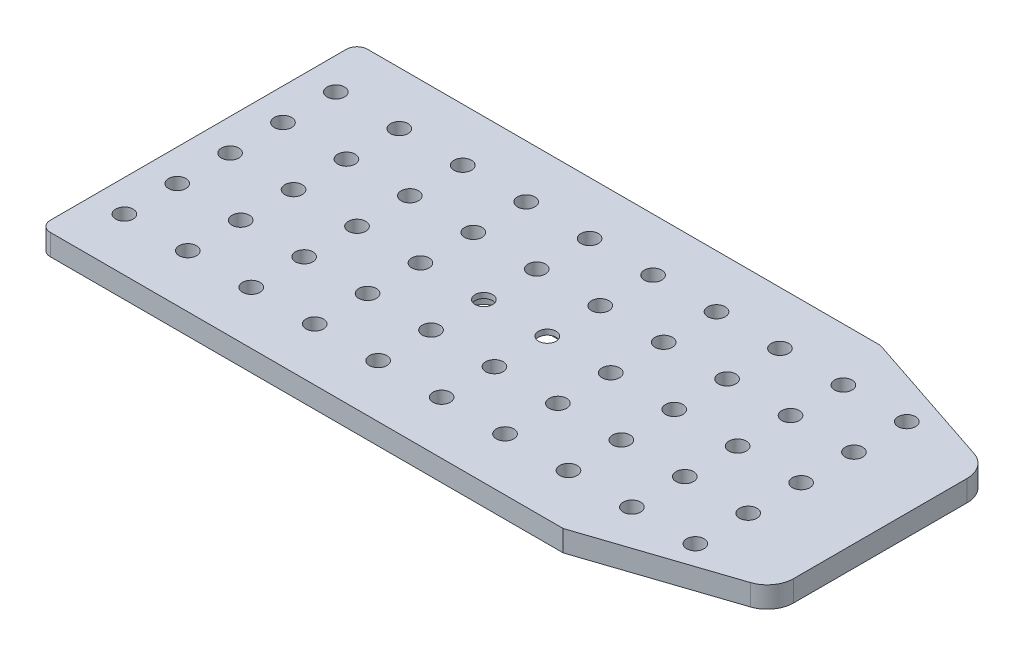
from build123d import *

# Parameters (mm, degrees)
SKETCH1_W           = 150
SKETCH1_H           = 90
BOSS_EXTRUDE1_DEPTH = 4
FILLET1_R           = 5
SKETCH2_R           = 1.65
CUT_EXTRUDE1_DEPTH  = 4
SKETCH3_R           = 2
CUT_EXTRUDE2_DEPTH  = 4
SKETCH4_W           = 62.892009783
SKETCH4_H           = 15
CUT_EXTRUDE3_DEPTH  = 33
FILLET2_R           = 5
CUT_EXTRUDE4_DEPTH  = 3
BOSS_EXTRUDE2_DEPTH = 4
FILLET3_R           = 5
SKETCH16_R          = 1.65
CUT_EXTRUDE5_DEPTH  = 3
CUT_EXTRUDE6_DEPTH  = 3
FILLET4_R           = 5
SKETCH19_W          = 109.521719542
SKETCH19_H          = 24.424509668
SKETCH19_W_2        = 104.116545636
SKETCH19_H_2        = 30.575224802
CUT_EXTRUDE7_DEPTH  = 20
CUT_EXTRUDE8_DEPTH  = 10
FILLET5_R           = 2


with BuildPart() as part:
    # Sketch1 → Boss-Extrude1 (new body)
    with BuildSketch(Plane(origin=(0, 0, 0), x_dir=(1, 0, 0), z_dir=(0, 1, 0))):
        Rectangle(SKETCH1_W, SKETCH1_H)
    extrude(amount=BOSS_EXTRUDE1_DEPTH)

    # Fillet1
    fillet1_edges = [part.edges().sort_by_distance(p)[0] for p in [
        (-75, 2, -45),
        (75, 2, -45),
        (75, 2, 45),
        (-75, 2, 45),
    ]]
    fillet(fillet1_edges, radius=FILLET1_R)

    # Sketch2 → Cut-Extrude1 (cut, symmetric)
    with BuildSketch(Plane(origin=(0, 4, 0), x_dir=(1, 0, 0), z_dir=(0, 1, 0))):
        with Locations((-70, 20)):
            Circle(SKETCH2_R)
        with Locations((-60, 20)):
            Circle(SKETCH2_R)
        with Locations((-70, 10)):
            Circle(SKETCH2_R)
        with Locations((-50, 20)):
            Circle(SKETCH2_R)
        with Locations((-70, 0)):
            Circle(SKETCH2_R)
        with Locations((-40, 20)):
            Circle(SKETCH2_R)
        with Locations((-70, -10)):
            Circle(SKETCH2_R)
        with Locations((-30, 20)):
            Circle(SKETCH2_R)
        with Locations((-70, -20)):
            Circle(SKETCH2_R)
        with Locations((-30, 10)):
            Circle(SKETCH2_R)
        with Locations((-60, -20)):
            Circle(SKETCH2_R)
        with Locations((-30, 0)):
            Circle(SKETCH2_R)
        with Locations((-50, -20)):
            Circle(SKETCH2_R)
        with Locations((-30, -10)):
            Circle(SKETCH2_R)
        with Locations((-40, -20)):
            Circle(SKETCH2_R)
        with Locations((-30, -20)):
            Circle(SKETCH2_R)
        with Locations((-60, 10)):
            Circle(SKETCH2_R)
        with Locations((-50, 10)):
            Circle(SKETCH2_R)
        with Locations((-40, 10)):
            Circle(SKETCH2_R)
        with Locations((-60, 0)):
            Circle(SKETCH2_R)
        with Locations((-50, 0)):
            Circle(SKETCH2_R)
        with Locations((-40, 0)):
            Circle(SKETCH2_R)
        with Locations((-60, -10)):
            Circle(SKETCH2_R)
        with Locations((-50, -10)):
            Circle(SKETCH2_R)
        with Locations((-40, -10)):
            Circle(SKETCH2_R)
        with Locations((-18, 20)):
            Circle(SKETCH2_R)
        with Locations((-18, 10)):
            Circle(SKETCH2_R)
        with Locations((-18, 0)):
            Circle(SKETCH2_R)
        with Locations((-18, -10)):
            Circle(SKETCH2_R)
        with Locations((-18, -20)):
            Circle(SKETCH2_R)
        with Locations((-6, 20)):
            Circle(SKETCH2_R)
        with Locations((-6, 10)):
            Circle(SKETCH2_R)
        with Locations((-6, 0)):
            Circle(SKETCH2_R)
        with Locations((-6, -10)):
            Circle(SKETCH2_R)
        with Locations((-6, -20)):
            Circle(SKETCH2_R)
        with Locations((6, 20)):
            Circle(SKETCH2_R)
        with Locations((6, 10)):
            Circle(SKETCH2_R)
        with Locations((6, 0)):
            Circle(SKETCH2_R)
        with Locations((6, -10)):
            Circle(SKETCH2_R)
        with Locations((6, -20)):
            Circle(SKETCH2_R)
        with Locations((18, 20)):
            Circle(SKETCH2_R)
        with Locations((18, 10)):
            Circle(SKETCH2_R)
        with Locations((18, 0)):
            Circle(SKETCH2_R)
        with Locations((18, -10)):
            Circle(SKETCH2_R)
        with Locations((18, -20)):
            Circle(SKETCH2_R)
        with Locations((30, 20)):
            Circle(SKETCH2_R)
        with Locations((30, 10)):
            Circle(SKETCH2_R)
        with Locations((30, 0)):
            Circle(SKETCH2_R)
        with Locations((30, -10)):
            Circle(SKETCH2_R)
        with Locations((30, -20)):
            Circle(SKETCH2_R)
        with Locations((42, 20)):
            Circle(SKETCH2_R)
        with Locations((42, 10)):
            Circle(SKETCH2_R)
        with Locations((42, 0)):
            Circle(SKETCH2_R)
        with Locations((42, -10)):
            Circle(SKETCH2_R)
        with Locations((42, -20)):
            Circle(SKETCH2_R)
        with Locations((54, 20)):
            Circle(SKETCH2_R)
        with Locations((54, 10)):
            Circle(SKETCH2_R)
        with Locations((54, 0)):
            Circle(SKETCH2_R)
        with Locations((54, -10)):
            Circle(SKETCH2_R)
        with Locations((54, -20)):
            Circle(SKETCH2_R)
    extrude(amount=CUT_EXTRUDE1_DEPTH, both=True, mode=Mode.SUBTRACT)

    # Sketch3 → Cut-Extrude2 (cut, symmetric)
    with BuildSketch(Plane(origin=(0, 4, 0), x_dir=(1, 0, 0), z_dir=(0, 1, 0))):
        with Locations((-70, 20)):
            Circle(SKETCH3_R)
    extrude(amount=CUT_EXTRUDE2_DEPTH, both=True, mode=Mode.SUBTRACT)

    # Sketch4 → Cut-Extrude3 (cut)
    with BuildSketch(Plane(origin=(0, 4, 0), x_dir=(1, 0, 0), z_dir=(0, 1, 0))):
        with Locations((-56.446004892, -37.5)):
            Rectangle(SKETCH4_W, SKETCH4_H)
        with Locations((-56.446004892, 37.5)):
            Rectangle(SKETCH4_W, SKETCH4_H)
    extrude(amount=-CUT_EXTRUDE3_DEPTH, mode=Mode.SUBTRACT)

    # Fillet2
    fillet2_edges = [part.edges().sort_by_distance(p)[0] for p in [
        (-25, 2, 45),
        (-25, 2, -45),
    ]]
    fillet(fillet2_edges, radius=FILLET2_R)

    # Sketch14 → Cut-Extrude4 (cut)
    with BuildSketch(Plane(origin=(0, 4, 0), x_dir=(1, 0, 0), z_dir=(0, 1, 0))):
        with BuildLine():
            ThreePointArc((65, 36), (68, 39), (65, 42))
            Line((65, 42), (35, 42))
            ThreePointArc((35, 42), (32, 39), (35, 36))
            Line((35, 36), (65, 36))
        make_face()
        with BuildLine():
            ThreePointArc((15, 36), (18, 39), (15, 42))
            Line((15, 42), (-15, 42))
            ThreePointArc((-15, 42), (-18, 39), (-15, 36))
            Line((-15, 36), (15, 36))
        make_face()
        with BuildLine():
            Line((35, -42), (65, -42))
            ThreePointArc((65, -42), (68, -39), (65, -36))
            Line((65, -36), (35, -36))
            ThreePointArc((35, -36), (32, -39), (35, -42))
        make_face()
        with BuildLine():
            ThreePointArc((-15, -36), (-18, -39), (-15, -42))
            Line((-15, -42), (15, -42))
            ThreePointArc((15, -42), (18, -39), (15, -36))
            Line((15, -36), (-15, -36))
        make_face()
    extrude(amount=-CUT_EXTRUDE4_DEPTH, mode=Mode.SUBTRACT)

    # Sketch15 → Boss-Extrude2 (add)
    with BuildSketch(Plane(origin=(0, 4, 0), x_dir=(1, 0, 0), z_dir=(0, 1, 0))):
        Polygon((75, 30), (75, -30), (105, -20), (105, 20), align=None)
    extrude(amount=-BOSS_EXTRUDE2_DEPTH)

    # Fillet3
    fillet3_edges = [part.edges().sort_by_distance(p)[0] for p in [
        (105, 2, -20),
        (105, 2, 20),
    ]]
    fillet(fillet3_edges, radius=FILLET3_R)

    # Sketch16 → Cut-Extrude5 (cut)
    with BuildSketch(Plane(origin=(0, 4, 0), x_dir=(1, 0, 0), z_dir=(0, 1, 0))):
        with Locations((66, 0)):
            Circle(SKETCH16_R)
        with Locations((90, 0)):
            Circle(SKETCH16_R)
        with Locations((78, 0)):
            Circle(SKETCH16_R)
        with Locations((78, 10)):
            Circle(SKETCH16_R)
        with Locations((90, 10)):
            Circle(SKETCH16_R)
        with Locations((78, 20)):
            Circle(SKETCH16_R)
        with Locations((90, 20)):
            Circle(SKETCH16_R)
        with Locations((66, 10)):
            Circle(SKETCH16_R)
        with Locations((66, 20)):
            Circle(SKETCH16_R)
        with Locations((66, -10)):
            Circle(SKETCH16_R)
        with Locations((78, -10)):
            Circle(SKETCH16_R)
        with Locations((90, -10)):
            Circle(SKETCH16_R)
        with Locations((66, -20)):
            Circle(SKETCH16_R)
        with Locations((78, -20)):
            Circle(SKETCH16_R)
        with Locations((90, -20)):
            Circle(SKETCH16_R)
    extrude(amount=-CUT_EXTRUDE5_DEPTH, mode=Mode.SUBTRACT)

    # Sketch18 → Cut-Extrude6 (cut)
    with BuildSketch(Plane(origin=(0, 0, 0), x_dir=(-1, 0, 0), z_dir=(0, -1, 0))):
        with BuildLine():
            Line((-30, -4.5), (-42, -4.5))
            ThreePointArc((-42, -4.5), (-46.5, 0), (-42, 4.5))
            Line((-42, 4.5), (-30, 4.5))
            ThreePointArc((-30, 4.5), (-25.5, 0), (-30, -4.5))
        make_face()
    extrude(amount=-CUT_EXTRUDE6_DEPTH, mode=Mode.SUBTRACT)

    # Fillet4
    fillet4_edges = [part.edges().sort_by_distance(p)[0] for p in [
        (-75, 2, 30),
        (-75, 2, -30),
    ]]
    fillet(fillet4_edges, radius=FILLET4_R)

    # Sketch19 → Cut-Extrude7 (cut)
    with BuildSketch(Plane(origin=(0, 4, 0), x_dir=(1, 0, 0), z_dir=(0, 1, 0))):
        with Locations((29.760859771, 42.212254834)):
            Rectangle(SKETCH19_W, SKETCH19_H)
        with Locations((27.058272818, -45.287612401)):
            Rectangle(SKETCH19_W_2, SKETCH19_H_2)
    extrude(amount=-CUT_EXTRUDE7_DEPTH, mode=Mode.SUBTRACT)

    # Sketch20 → Cut-Extrude8 (cut)
    with BuildSketch(Plane(origin=(0, 4, 0), x_dir=(1, 0, 0), z_dir=(0, 1, 0))):
        Polygon((-87.558931241, 38.2889157), (-87.558931241, -42.862590317), (-24, -42.862590317), (-24, 0), (-24, 38.2889157), align=None)
    extrude(amount=-CUT_EXTRUDE8_DEPTH, mode=Mode.SUBTRACT)

    # Fillet5
    fillet5_edges = [part.edges().sort_by_distance(p)[0] for p in [
        (-24, 2, -30),
        (-24, 2, 30),
    ]]
    fillet(fillet5_edges, radius=FILLET5_R)


solid = part.part
